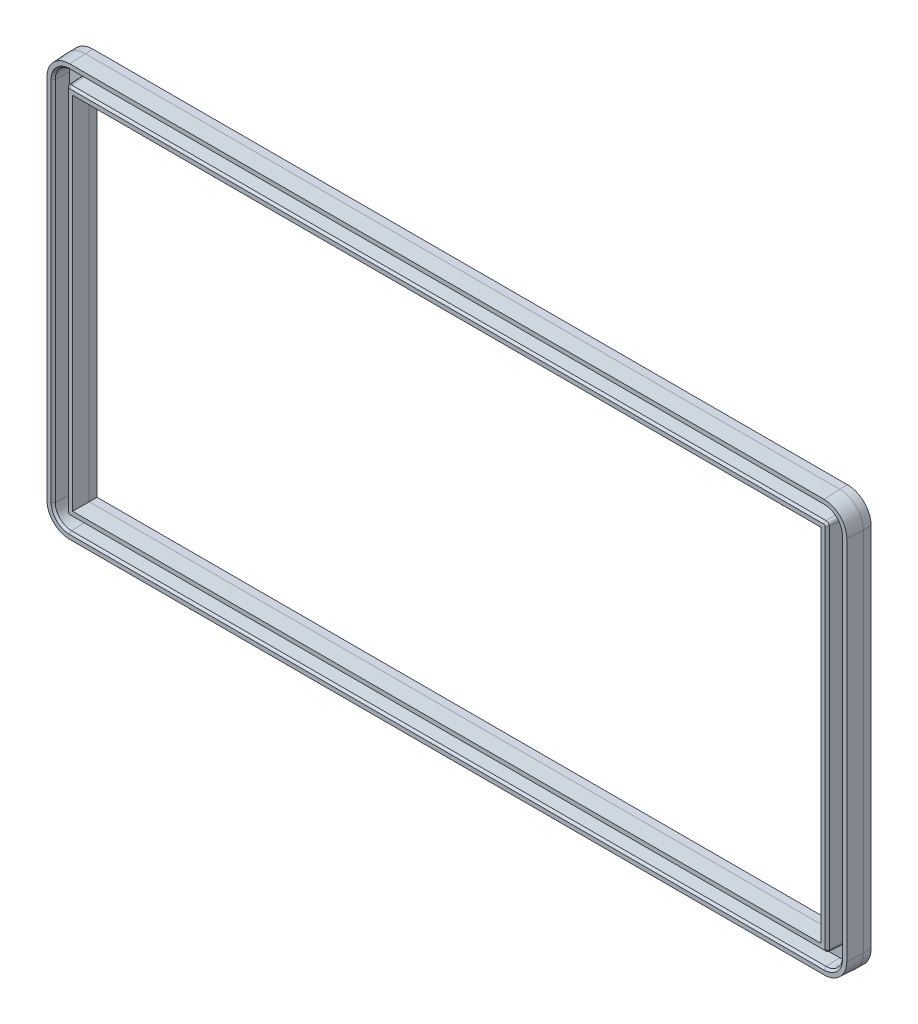
from build123d import *
from OCP.BRepFilletAPI import BRepFilletAPI_MakeChamfer

# Parameters (mm, degrees)
BOSS_EXTRU_1_DEPTH           = 4
BOSS_EXTRU_1_DRAFT           = 3
ESQUISSE1_W                  = 190.5
ESQUISSE1_H                  = 91.5
BOSS_EXTRU_1_PROFILE_2_DEPTH = 4
BOSS_EXTRU_1_PROFILE_2_DRAFT = 3
ESQUISSE1_4_W                = 190.5
ESQUISSE1_4_H                = 91.5
BOSS_EXTRU_2_DEPTH           = 2
CHANFREIN1_SIZE              = 0.528377251
CHANFREIN1_SIZE_2            = 0.5
CHANFREIN2_SIZE              = 0.528377251
CHANFREIN2_SIZE_2            = 0.5


with BuildPart() as part:
    # Esquisse1 → Boss.-Extru.1 (with draft: the straight prism first)
    with BuildSketch(Plane.XY):
        with BuildLine():
            Line((-1, -98.5), (191.5, -98.5))
            ThreePointArc((191.5, -98.5), (195.742640687, -96.742640687), (197.5, -92.5))
            Line((197.5, -92.5), (197.5, 1))
            ThreePointArc((197.5, 1), (195.742640687, 5.242640687), (191.5, 7))
            Line((191.5, 7), (-1, 7))
            ThreePointArc((-1, 7), (-5.242640687, 5.242640687), (-7, 1))
            Line((-7, 1), (-7, -92.5))
            ThreePointArc((-7, -92.5), (-5.242640687, -96.742640687), (-1, -98.5))
        make_face()
        with BuildLine():
            Line((-1, -96.5), (191.5, -96.5))
            ThreePointArc((191.5, -96.5), (194.328427125, -95.328427125), (195.5, -92.5))
            Line((195.5, -92.5), (195.5, 1))
            ThreePointArc((195.5, 1), (194.328427125, 3.828427125), (191.5, 5))
            Line((191.5, 5), (-1, 5))
            ThreePointArc((-1, 5), (-3.828427125, 3.828427125), (-5, 1))
            Line((-5, 1), (-5, -92.5))
            ThreePointArc((-5, -92.5), (-3.828427125, -95.328427125), (-1, -96.5))
        make_face(mode=Mode.SUBTRACT)
    extrude(amount=BOSS_EXTRU_1_DEPTH)
    # Boss.-Extru.1: the draft: its side faces are tilted about the plane it starts from
    boss_extru_1_sides = [part.faces().sort_by_distance(p)[0] for p in [
        (-5.242640687, -96.742640687, 2),
        (95.25, -98.5, 2),
        (195.742640687, -96.742640687, 2),
        (197.5, -45.75, 2),
        (195.742640687, 5.242640687, 2),
        (95.25, 7, 2),
        (-5.242640687, 5.242640687, 2),
        (-7, -45.75, 2),
        (-5, -45.75, 2),
        (-3.828427125, 3.828427125, 2),
        (95.25, 5, 2),
        (194.328427125, 3.828427125, 2),
        (195.5, -45.75, 2),
        (194.328427125, -95.328427125, 2),
        (95.25, -96.5, 2),
        (-3.828427125, -95.328427125, 2),
    ]]
    draft(boss_extru_1_sides, Plane.XY, BOSS_EXTRU_1_DRAFT)



with BuildPart() as body_2:
    # Esquisse1 → Boss.-Extru.1 profile 2 (with draft: the straight prism first)
    with BuildSketch(Plane.XY):
        with BuildLine():
            Line((-1, -93.5), (191.5, -93.5))
            ThreePointArc((191.5, -93.5), (192.207106781, -93.207106781), (192.5, -92.5))
            Line((192.5, -92.5), (192.5, 1))
            ThreePointArc((192.5, 1), (192.207106781, 1.707106781), (191.5, 2))
            Line((191.5, 2), (-1, 2))
            ThreePointArc((-1, 2), (-1.707106781, 1.707106781), (-2, 1))
            Line((-2, 1), (-2, -92.5))
            ThreePointArc((-2, -92.5), (-1.707106781, -93.207106781), (-1, -93.5))
        make_face()
        with Locations((95.25, -45.75)):
            Rectangle(ESQUISSE1_W, ESQUISSE1_H, mode=Mode.SUBTRACT)
    extrude(amount=BOSS_EXTRU_1_PROFILE_2_DEPTH)
    # Boss.-Extru.1 profile 2: the draft: its side faces are tilted about the plane it starts from
    boss_extru_1_profile_2_sides = [body_2.faces().sort_by_distance(p)[0] for p in [
        (-1.707106781, -93.207106781, 2),
        (95.25, -93.5, 2),
        (192.207106781, -93.207106781, 2),
        (192.5, -45.75, 2),
        (192.207106781, 1.707106781, 2),
        (95.25, 2, 2),
        (-1.707106781, 1.707106781, 2),
        (-2, -45.75, 2),
        (95.25, 0, 2),
        (190.5, -45.75, 2),
        (95.25, -91.5, 2),
        (0, -45.75, 2),
    ]]
    draft(boss_extru_1_profile_2_sides, Plane.XY, BOSS_EXTRU_1_PROFILE_2_DRAFT)


with BuildPart() as part_1:
    add(part.part)

    add(body_2.part)  # Boss.-Extru.2 merges body 2
    # Esquisse1<4> → Boss.-Extru.2 (add)
    with BuildSketch(Plane.XY):
        with BuildLine():
            Line((-1, -98.5), (191.5, -98.5))
            ThreePointArc((191.5, -98.5), (195.742640687, -96.742640687), (197.5, -92.5))
            Line((197.5, -92.5), (197.5, 1))
            ThreePointArc((197.5, 1), (195.742640687, 5.242640687), (191.5, 7))
            Line((191.5, 7), (-1, 7))
            ThreePointArc((-1, 7), (-5.242640687, 5.242640687), (-7, 1))
            Line((-7, 1), (-7, -92.5))
            ThreePointArc((-7, -92.5), (-5.242640687, -96.742640687), (-1, -98.5))
        make_face()
        with Locations((95.25, -45.75)):
            Rectangle(ESQUISSE1_4_W, ESQUISSE1_4_H, mode=Mode.SUBTRACT)
    extrude(amount=-BOSS_EXTRU_2_DEPTH)

    # Chanfrein1
    chanfrein1_edges_1 = [part_1.edges().sort_by_distance(p)[0] for p in [
        (-1.558875197, -93.058875197, 4),
    ]]
    chanfrein1_side_1 = [part_1.faces().sort_by_distance(p)[0] for p in [
        (-1.559245268, -93.059245268, 3.990013705),
    ]]
    chanfrein1_edges_2 = [part_1.edges().sort_by_distance(p)[0] for p in [
        (-1.790368883, -45.75, 4),
    ]]
    chanfrein1_side_2 = [part_1.faces().sort_by_distance(p)[0] for p in [
        (-1.790892242, -45.75, 3.990013705),
    ]]
    chanfrein1_edges_3 = [part_1.edges().sort_by_distance(p)[0] for p in [
        (95.25, -93.290368883, 4),
    ]]
    chanfrein1_side_3 = [part_1.faces().sort_by_distance(p)[0] for p in [
        (95.25, -93.290892242, 3.990013705),
    ]]
    chanfrein1_edges_4 = [part_1.edges().sort_by_distance(p)[0] for p in [
        (192.058875197, -93.058875197, 4),
    ]]
    chanfrein1_side_4 = [part_1.faces().sort_by_distance(p)[0] for p in [
        (192.051804129, -93.051804129, 4),
    ]]
    chanfrein1_edges_5 = [part_1.edges().sort_by_distance(p)[0] for p in [
        (192.290368883, -45.75, 4),
    ]]
    chanfrein1_side_5 = [part_1.faces().sort_by_distance(p)[0] for p in [
        (192.280368883, -45.75, 4),
    ]]
    chanfrein1_edges_6 = [part_1.edges().sort_by_distance(p)[0] for p in [
        (192.058875197, 1.558875197, 4),
    ]]
    chanfrein1_side_6 = [part_1.faces().sort_by_distance(p)[0] for p in [
        (192.051804129, 1.551804129, 4),
    ]]
    chanfrein1_edges_7 = [part_1.edges().sort_by_distance(p)[0] for p in [
        (95.25, 1.790368883, 4),
    ]]
    chanfrein1_side_7 = [part_1.faces().sort_by_distance(p)[0] for p in [
        (95.25, 1.780368883, 4),
    ]]
    chanfrein1_edges_8 = [part_1.edges().sort_by_distance(p)[0] for p in [
        (-1.558875197, 1.558875197, 4),
    ]]
    chanfrein1_side_8 = [part_1.faces().sort_by_distance(p)[0] for p in [
        (-1.551804129, 1.551804129, 4),
    ]]
    chanfrein1 = BRepFilletAPI_MakeChamfer(part_1.part.solid().wrapped)
    for e in chanfrein1_edges_1:
        chanfrein1.Add(CHANFREIN1_SIZE, CHANFREIN1_SIZE_2, e.wrapped, chanfrein1_side_1[0].wrapped)
    for e in chanfrein1_edges_2:
        chanfrein1.Add(CHANFREIN1_SIZE, CHANFREIN1_SIZE_2, e.wrapped, chanfrein1_side_2[0].wrapped)
    for e in chanfrein1_edges_3:
        chanfrein1.Add(CHANFREIN1_SIZE, CHANFREIN1_SIZE_2, e.wrapped, chanfrein1_side_3[0].wrapped)
    for e in chanfrein1_edges_4:
        chanfrein1.Add(CHANFREIN1_SIZE_2, CHANFREIN1_SIZE, e.wrapped, chanfrein1_side_4[0].wrapped)
    for e in chanfrein1_edges_5:
        chanfrein1.Add(CHANFREIN1_SIZE_2, CHANFREIN1_SIZE, e.wrapped, chanfrein1_side_5[0].wrapped)
    for e in chanfrein1_edges_6:
        chanfrein1.Add(CHANFREIN1_SIZE_2, CHANFREIN1_SIZE, e.wrapped, chanfrein1_side_6[0].wrapped)
    for e in chanfrein1_edges_7:
        chanfrein1.Add(CHANFREIN1_SIZE, CHANFREIN1_SIZE_2, e.wrapped, chanfrein1_side_7[0].wrapped)
    for e in chanfrein1_edges_8:
        chanfrein1.Add(CHANFREIN1_SIZE_2, CHANFREIN1_SIZE, e.wrapped, chanfrein1_side_8[0].wrapped)
    add(Compound.cast(chanfrein1.Shape()), mode=Mode.REPLACE)

    # Chanfrein2
    chanfrein2_edges_1 = [part_1.edges().sort_by_distance(p)[0] for p in [
        (-3.976658709, 3.976658709, 4),
    ]]
    chanfrein2_side_1 = [part_1.faces().sort_by_distance(p)[0] for p in [
        (-3.976288638, 3.976288638, 3.990013705),
    ]]
    chanfrein2_edges_2 = [part_1.edges().sort_by_distance(p)[0] for p in [
        (95.25, 5.209631117, 4),
    ]]
    chanfrein2_side_2 = [part_1.faces().sort_by_distance(p)[0] for p in [
        (95.25, 5.209107758, 3.990013705),
    ]]
    chanfrein2_edges_3 = [part_1.edges().sort_by_distance(p)[0] for p in [
        (-5.209631117, -45.75, 4),
    ]]
    chanfrein2_side_3 = [part_1.faces().sort_by_distance(p)[0] for p in [
        (-5.209107758, -45.75, 3.990013705),
    ]]
    chanfrein2_edges_4 = [part_1.edges().sort_by_distance(p)[0] for p in [
        (194.476658709, 3.976658709, 4),
    ]]
    chanfrein2_side_4 = [part_1.faces().sort_by_distance(p)[0] for p in [
        (194.476288638, 3.976288638, 3.990013705),
    ]]
    chanfrein2_edges_5 = [part_1.edges().sort_by_distance(p)[0] for p in [
        (-3.976658709, -95.476658709, 4),
    ]]
    chanfrein2_side_5 = [part_1.faces().sort_by_distance(p)[0] for p in [
        (-3.976288638, -95.476288638, 3.990013705),
    ]]
    chanfrein2_edges_6 = [part_1.edges().sort_by_distance(p)[0] for p in [
        (195.709631117, -45.75, 4),
    ]]
    chanfrein2_side_6 = [part_1.faces().sort_by_distance(p)[0] for p in [
        (195.709107758, -45.75, 3.990013705),
    ]]
    chanfrein2_edges_7 = [part_1.edges().sort_by_distance(p)[0] for p in [
        (95.25, -96.709631117, 4),
    ]]
    chanfrein2_side_7 = [part_1.faces().sort_by_distance(p)[0] for p in [
        (95.25, -96.709107758, 3.990013705),
    ]]
    chanfrein2_edges_8 = [part_1.edges().sort_by_distance(p)[0] for p in [
        (194.476658709, -95.476658709, 4),
    ]]
    chanfrein2_side_8 = [part_1.faces().sort_by_distance(p)[0] for p in [
        (194.476288638, -95.476288638, 3.990013705),
    ]]
    chanfrein2 = BRepFilletAPI_MakeChamfer(part_1.part.solid().wrapped)
    for e in chanfrein2_edges_1:
        chanfrein2.Add(CHANFREIN2_SIZE, CHANFREIN2_SIZE_2, e.wrapped, chanfrein2_side_1[0].wrapped)
    for e in chanfrein2_edges_2:
        chanfrein2.Add(CHANFREIN2_SIZE, CHANFREIN2_SIZE_2, e.wrapped, chanfrein2_side_2[0].wrapped)
    for e in chanfrein2_edges_3:
        chanfrein2.Add(CHANFREIN2_SIZE, CHANFREIN2_SIZE_2, e.wrapped, chanfrein2_side_3[0].wrapped)
    for e in chanfrein2_edges_4:
        chanfrein2.Add(CHANFREIN2_SIZE_2, CHANFREIN2_SIZE, e.wrapped, chanfrein2_side_4[0].wrapped)
    for e in chanfrein2_edges_5:
        chanfrein2.Add(CHANFREIN2_SIZE, CHANFREIN2_SIZE_2, e.wrapped, chanfrein2_side_5[0].wrapped)
    for e in chanfrein2_edges_6:
        chanfrein2.Add(CHANFREIN2_SIZE, CHANFREIN2_SIZE_2, e.wrapped, chanfrein2_side_6[0].wrapped)
    for e in chanfrein2_edges_7:
        chanfrein2.Add(CHANFREIN2_SIZE, CHANFREIN2_SIZE_2, e.wrapped, chanfrein2_side_7[0].wrapped)
    for e in chanfrein2_edges_8:
        chanfrein2.Add(CHANFREIN2_SIZE, CHANFREIN2_SIZE_2, e.wrapped, chanfrein2_side_8[0].wrapped)
    add(Compound.cast(chanfrein2.Shape()), mode=Mode.REPLACE)


solid = part_1.part
